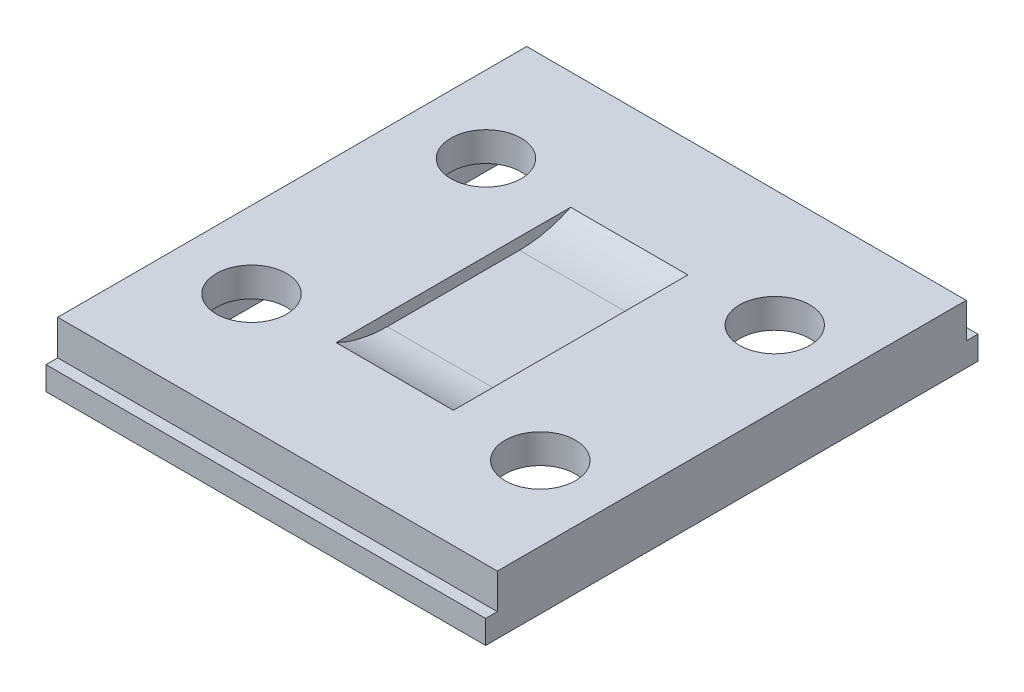
from build123d import *

# Parameters (mm, degrees)
SKETCH1_W           = 37.5
SKETCH1_H           = 42
BOSS_EXTRUDE1_DEPTH = 5
SKETCH2_W           = 37.5
SKETCH2_H           = 1
CUT_EXTRUDE1_DEPTH  = 3
SKETCH3_W           = 37.5
SKETCH3_H           = 1
CUT_EXTRUDE2_DEPTH  = 3
SKETCH4_W           = 10
SKETCH4_H           = 20
CUT_EXTRUDE3_DEPTH  = 1
FILLET1_R           = 10
FILLET2_R           = 10
SHELL1_START        = -16.25
SHELL1_DEPTH        = 32.5
SHELL1_2_DEPTH      = 8.75
SHELL1_START_2      = 7.5
SHELL1_3_DEPTH      = 8.75
SKETCH5_R           = 3
CUT_EXTRUDE4_DEPTH  = 2.5


# Read off the part's stored shape, not the designer's step: Shell1
with BuildPart() as part:
    # Sketch1 → Boss-Extrude1 (new body)
    with BuildSketch(Plane(origin=(0, 0, 0), x_dir=(1, 0, 0), z_dir=(0, 1, 0))):
        Rectangle(SKETCH1_W, SKETCH1_H)
    extrude(amount=BOSS_EXTRUDE1_DEPTH)

    # Sketch2 → Cut-Extrude1 (cut)
    with BuildSketch(Plane(origin=(0, 5, 0), x_dir=(1, 0, 0), z_dir=(0, 1, 0))):
        with Locations((0, -20.5)):
            Rectangle(SKETCH2_W, SKETCH2_H)
    extrude(amount=-CUT_EXTRUDE1_DEPTH, mode=Mode.SUBTRACT)

    # Sketch3 → Cut-Extrude2 (cut)
    with BuildSketch(Plane(origin=(0, 5, 0), x_dir=(1, 0, 0), z_dir=(0, 1, 0))):
        with Locations((0, 20.5)):
            Rectangle(SKETCH3_W, SKETCH3_H)
    extrude(amount=-CUT_EXTRUDE2_DEPTH, mode=Mode.SUBTRACT)

    # Sketch4 → Cut-Extrude3 (cut)
    with BuildSketch(Plane(origin=(0, 5, 0), x_dir=(1, 0, 0), z_dir=(0, 1, 0))):
        Rectangle(SKETCH4_W, SKETCH4_H)
    extrude(amount=-CUT_EXTRUDE3_DEPTH, mode=Mode.SUBTRACT)

    # Fillet1
    # the kernel refuses this fillet: 10 mm, written as the material it adds along each edge
    with BuildSketch(Plane(origin=(15.897247359, 4, -10), x_dir=(0, 1, 0), z_dir=(-1, 0, 0))) as fillet1_piece_1:
        with BuildLine():
            CenterArc((10, -4.358898944), FILLET1_R, 154.158067237, 25.841932763)
            Line((0, -4.358898944), (-0.2, -4.358898944))
            Line((-0.2, -4.358898944), (-0.2, 0))
            Line((-0.2, 0), (0, 0.2))
            ThreePointArc((0, 0.2), (0.5, 0.2), (0.82, 0.087177979))
            Line((0.82, 0.087177979), (1, 0))
        make_face()
    extrude(amount=31.794494718)

    # Fillet2
    # the kernel refuses this fillet: 10 mm, written as the material it adds along each edge
    with BuildSketch(Plane(origin=(-15.897247359, 4, 10), x_dir=(0, 0, -1), z_dir=(1, 0, 0))) as fillet2_piece_1:
        with BuildLine():
            CenterArc((4.358898944, 10), FILLET2_R, 244.158067237, 25.841932763)
            Line((0, 1), (-0.087177979, 0.82))
            ThreePointArc((-0.087177979, 0.82), (-0.2, 0.5), (-0.2, 0))
            Line((-0.2, 0), (0, -0.2))
            Line((0, -0.2), (4.358898944, -0.2))
            Line((4.358898944, -0.2), (4.358898944, 0))
        make_face()
    extrude(amount=31.794494718)

    # Shell1 outline → Shell1 (cut)
    with BuildSketch(Plane.YZ.offset(SHELL1_START)):
        with BuildLine():
            Line((0, -17.5), (2.5, -17.5))
            Line((2.5, -17.5), (2.5, -10.540080542))
            ThreePointArc((2.5, -10.540080542), (1.752551286, -8.141101056), (1.5, -5.641101056))
            Line((1.5, -5.641101056), (1.5, 5.641101056))
            ThreePointArc((1.5, 5.641101056), (1.752551286, 8.141101056), (2.5, 10.540080542))
            Line((2.5, 10.540080542), (2.5, 17.5))
            Line((2.5, 17.5), (0, 17.5))
            Line((0, 17.5), (0, -17.5))
        make_face()
    extrude(amount=SHELL1_DEPTH, mode=Mode.SUBTRACT)

    # Shell1 2 outline → Shell1 2 (cut)
    with BuildSketch(Plane.YZ.offset(SHELL1_START)):
        with BuildLine():
            ThreePointArc((1.5, -5.641101056), (1.752551286, -8.141101056), (2.5, -10.540080542))
            Line((2.5, -10.540080542), (2.5, 10.540080542))
            ThreePointArc((2.5, 10.540080542), (1.752551286, 8.141101056), (1.5, 5.641101056))
            Line((1.5, 5.641101056), (1.5, -5.641101056))
        make_face()
    extrude(amount=SHELL1_2_DEPTH, mode=Mode.SUBTRACT)

    # Shell1 3 outline → Shell1 3 (cut)
    with BuildSketch(Plane.YZ.offset(SHELL1_START_2)):
        with BuildLine():
            ThreePointArc((1.5, -5.641101056), (1.752551286, -8.141101056), (2.5, -10.540080542))
            Line((2.5, -10.540080542), (2.5, 10.540080542))
            ThreePointArc((2.5, 10.540080542), (1.752551286, 8.141101056), (1.5, 5.641101056))
            Line((1.5, 5.641101056), (1.5, -5.641101056))
        make_face()
    extrude(amount=SHELL1_3_DEPTH, mode=Mode.SUBTRACT)

    # Sketch5 → Cut-Extrude4 (cut)
    with BuildSketch(Plane(origin=(0, 5, 0), x_dir=(1, 0, 0), z_dir=(0, 1, 0))):
        with Locations(Location((-12.220002529, -10, 0), (0, 0, 270))):
            Circle(SKETCH5_R)
        with Locations(Location((-12.220002529, 10, 0), (0, 0, 270))):
            Circle(SKETCH5_R)
        with Locations(Location((12.411971657, -10, 0), (0, 0, 270))):
            Circle(SKETCH5_R)
        with Locations(Location((12.411971657, 10, 0), (0, 0, 270))):
            Circle(SKETCH5_R)
    extrude(amount=-CUT_EXTRUDE4_DEPTH, mode=Mode.SUBTRACT)


solid = part.part
